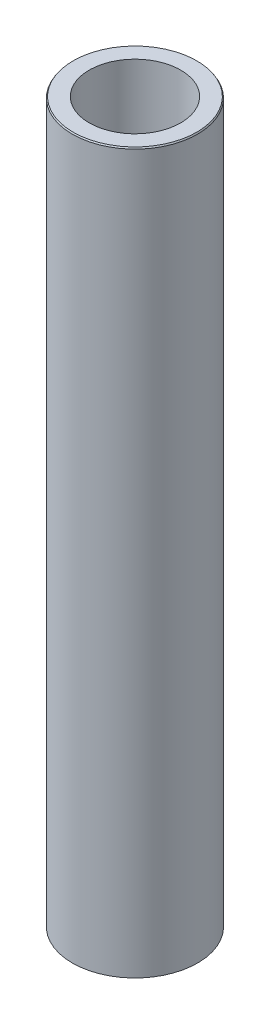
from build123d import *
from OCP.BRepFilletAPI import BRepFilletAPI_MakeChamfer

# Parameters (mm, degrees)
SKETCH1_R           = 30
BOSS_EXTRUDE1_DEPTH = 344.799066649
SKETCH2_R           = 21.911106649
CUT_EXTRUDE1_DEPTH  = 348.399476629
CHAMFER1_SIZE       = 0.636736293
CHAMFER1_SIZE2      = 0.386848551


with BuildPart() as part:
    # Sketch1 → Boss-Extrude1 (new body)
    with BuildSketch(Plane(origin=(0, 0, 0), x_dir=(1, 0, 0), z_dir=(0, 1, 0))):
        Circle(SKETCH1_R)
    extrude(amount=BOSS_EXTRUDE1_DEPTH)

    # Sketch2 → Cut-Extrude1 (cut, through all)
    with BuildSketch(Plane(origin=(0, 0, 0), x_dir=(1, 0, 0), z_dir=(0, 1, 0))):
        Circle(SKETCH2_R)
    extrude(amount=CUT_EXTRUDE1_DEPTH, mode=Mode.SUBTRACT)

    # Chamfer1: one chamfer whose edges measure the first distance from different faces: ONE call of the kernel's chamfer builder (chamfer() names one face for all edges)
    chamfer1_edges_1 = [part.edges().sort_by_distance(p)[0] for p in [
        (-30, 344.799066649, 0),
    ]]
    chamfer1_side_1 = [part.faces().sort_by_distance(p)[0] for p in [
        (-30, 172.399533325, 0),
    ]]
    chamfer1_edges_2 = [part.edges().sort_by_distance(p)[0] for p in [
        (-30, 0, 0),
    ]]
    chamfer1_side_2 = [part.faces().sort_by_distance(p)[0] for p in [
        (-29.151471863, 0, 0),
    ]]
    chamfer1 = BRepFilletAPI_MakeChamfer(part.part.solid().wrapped)
    for e in chamfer1_edges_1:
        chamfer1.Add(CHAMFER1_SIZE, CHAMFER1_SIZE2, e.wrapped, chamfer1_side_1[0].wrapped)  # the first distance lies on this face
    for e in chamfer1_edges_2:
        chamfer1.Add(CHAMFER1_SIZE, CHAMFER1_SIZE2, e.wrapped, chamfer1_side_2[0].wrapped)  # the first distance lies on this face
    add(Compound.cast(chamfer1.Shape()), mode=Mode.REPLACE)


solid = part.part
